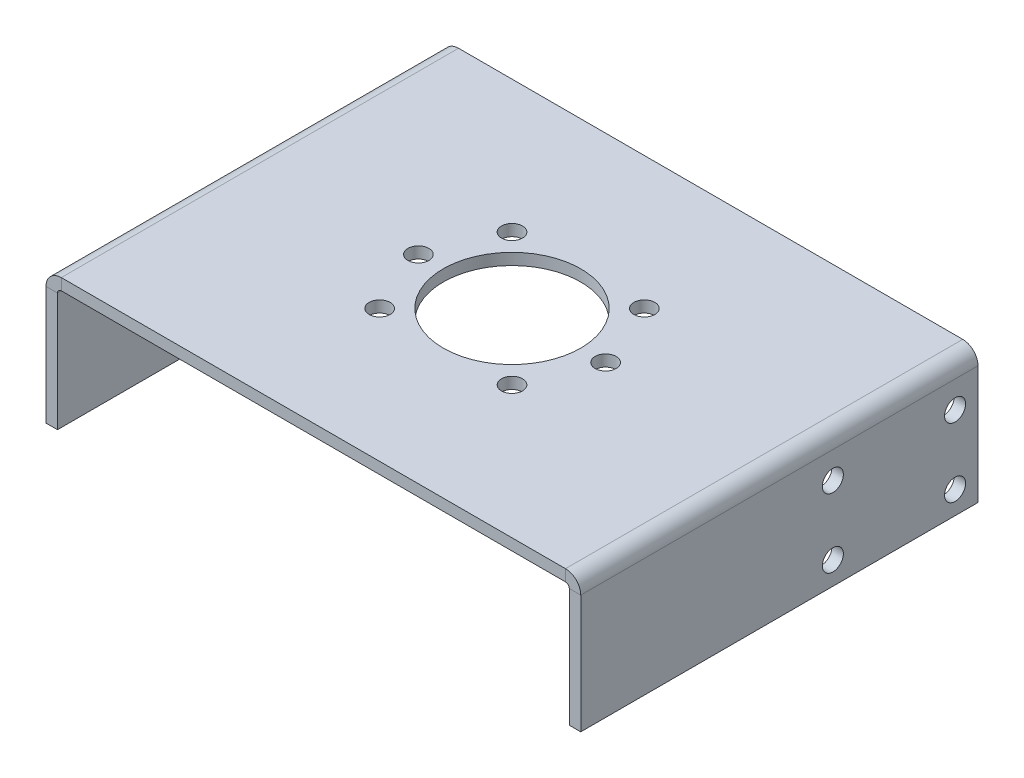
from build123d import *

# Parameters (mm, degrees)
SM_BASE_FLANGE_1_DEPTH = 104
SKETCH_6_R             = 2.75
CUT_EXTRUDE_1_DEPTH    = 3
SKETCH_7_R             = 2.75
CUT_EXTRUDE_3_DEPTH    = 3
SKETCH_8_R             = 18
CUT_EXTRUDE_4_DEPTH    = 3


# Sheet-metal steps are written as plain solids
with BuildPart() as part:
    # Sketch 1 → 基体-法兰1 (new body)
    with BuildSketch(Plane.XY):
        with BuildLine():
            Line((-70, -35), (-70, -4))
            ThreePointArc((-70, -4), (-68.828427125, -1.171572875), (-66, 0))
            Line((-66, 0), (66, 0))
            ThreePointArc((66, 0), (68.828427125, -1.171572875), (70, -4))
            Line((70, -4), (70, -35))
            Line((70, -35), (67, -35))
            Line((67, -35), (67, -4))
            ThreePointArc((67, -4), (66.707106781, -3.292893219), (66, -3))
            Line((66, -3), (-66, -3))
            ThreePointArc((-66, -3), (-66.707106781, -3.292893219), (-67, -4))
            Line((-67, -4), (-67, -35))
            Line((-67, -35), (-70, -35))
        make_face()
    extrude(amount=SM_BASE_FLANGE_1_DEPTH)

    # 草图6 → 切除-拉伸1 (cut)
    with BuildSketch(Plane(origin=(0, 0, 0), x_dir=(1, 0, 0), z_dir=(0, 1, 0))):
        with Locations(Location((24.5, -52, 0), (0, 0, 270))):
            Circle(SKETCH_6_R)
        with Locations(Location((17.324116139, -69.324116139, 0), (0, 0, 270))):
            Circle(SKETCH_6_R)
        with Locations(Location((-17.324116139, -69.324116139, 0), (0, 0, 270))):
            Circle(SKETCH_6_R)
        with Locations(Location((-24.5, -52, 0), (0, 0, 270))):
            Circle(SKETCH_6_R)
        with Locations(Location((-17.324116139, -34.675883861, 0), (0, 0, 270))):
            Circle(SKETCH_6_R)
        with Locations(Location((17.324116139, -34.675883861, 0), (0, 0, 270))):
            Circle(SKETCH_6_R)
    extrude(amount=-CUT_EXTRUDE_1_DEPTH, mode=Mode.SUBTRACT)

    # 草图7 → 切除-拉伸3 (cut)
    with BuildSketch(Plane.ZY.offset(70)):
        with Locations(Location((38, -29, 0), (0, 0, 270))):
            Circle(SKETCH_7_R)
        with Locations(Location((38, -11, 0), (0, 0, 270))):
            Circle(SKETCH_7_R)
        with Locations(Location((6, -11, 0), (0, 0, 270))):
            Circle(SKETCH_7_R)
        with Locations(Location((6, -29, 0), (0, 0, 270))):
            Circle(SKETCH_7_R)
    cut_extrude_3 = extrude(amount=-CUT_EXTRUDE_3_DEPTH, mode=Mode.SUBTRACT)

    # 镜向2: 切除-拉伸3 across plane
    add(cut_extrude_3.mirror(Plane(origin=(0, 0, 0), x_dir=(0, 0, 1), z_dir=(1, 0, 0))), mode=Mode.SUBTRACT)

    # 草图8 → 切除-拉伸4 (cut)
    with BuildSketch(Plane(origin=(0, 0, 0), x_dir=(1, 0, 0), z_dir=(0, 1, 0))):
        with Locations(Location((0, -52, 0), (0, 0, 270))):
            Circle(SKETCH_8_R)
    extrude(amount=-CUT_EXTRUDE_4_DEPTH, mode=Mode.SUBTRACT)


solid = part.part
